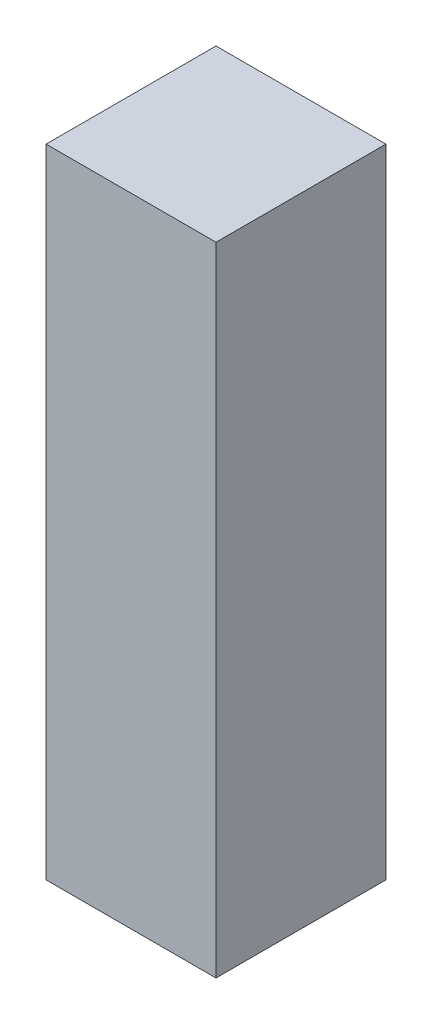
from build123d import *

# Parameters (mm, degrees)
SKETCH1_W           = 101.6
SKETCH1_H           = 101.6
BOSS_EXTRUDE1_DEPTH = 381


with BuildPart() as part:
    # Sketch1 → Boss-Extrude1 (new body)
    with BuildSketch(Plane(origin=(0, 0, 0), x_dir=(1, 0, 0), z_dir=(0, 1, 0))):
        with Locations((14.205295171, 3.610152284)):
            Rectangle(SKETCH1_W, SKETCH1_H)
    extrude(amount=-BOSS_EXTRUDE1_DEPTH)


solid = part.part
